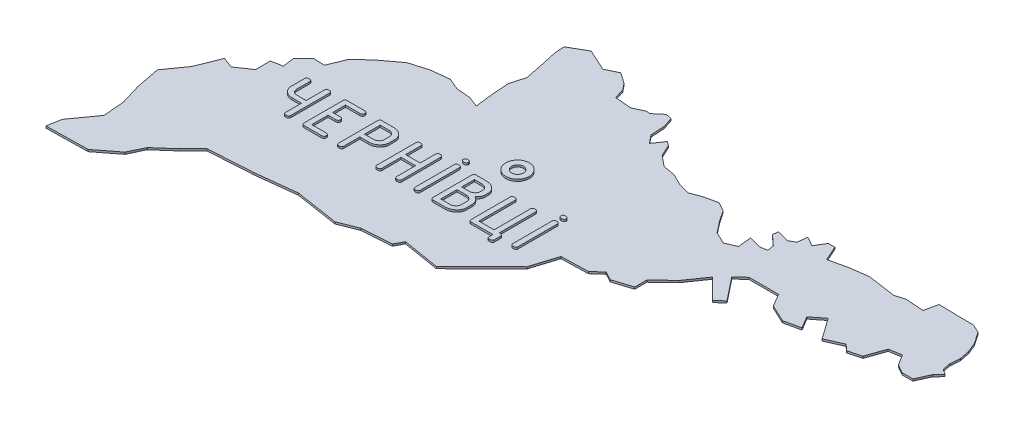
from build123d import *

# Parameters (mm, degrees)
EXTRUDE_1_DEPTH = 5
SKETCH_2_R      = 30
SKETCH_2_R_2    = 15
EXTRUDE_2_DEPTH = 10
SCALE_1_SCALE   = 0.05


with BuildPart() as part:
    # Эскиз1 → Бобышка-Вытянуть1 (new body)
    with BuildSketch(Plane(origin=(0, 0, 0), x_dir=(1, 0, 0), z_dir=(0, 1, 0))):
        Polygon((-5161.27238, 3670.78768), (-5205.41504, 3609.16728), (-5211.88188, 3573.49044), (-5106.11882, 3575.42084), (-5053.5586, 3616.30722), (-5034.72704, 3655.20986), (-4991.90264, 3692.87044), (-4956.1877, 3728.57268), (-4843.29232, 3735.71262), (-4741.41292, 3747.3763), (-4631.74334, 3730.50308), (-4584.3571, 3749.3321), (-4509.09182, 3754.51624), (-4497.41544, 3776.5482), (-4403.32368, 3760.99578), (-4287.14154, 3875.87744), (-4266.38212, 3942.07238), (-4198.25678, 3944.00532), (-4174.24362, 3965.42514), (-4152.16086, 3953.73606), (-4104.79494, 3968.65348), (-4104.79494, 3999.80658), (-4061.97816, 4040.69296), (-4027.57132, 4090.01468), (-3976.31666, 4038.76256), (-3956.19224, 4055.60784), (-4003.55816, 4115.32324), (-3980.2054, 4136.0852), (-3904.94012, 4136.0852), (-3886.10856, 4103.63416), (-3841.97098, 4082.87474), (-3801.0846, 4091.94762), (-3819.27862, 4122.46572), (-3788.78592, 4146.47888), (-3751.12788, 4093.29382), (-3708.9715, 4112.09744), (-3693.36828, 4098.45256), (-3660.91978, 4106.8879), (-3644.04656, 4154.91422), (-3612.91886, 4160.09836), (-3596.02024, 4132.83146), (-3573.96288, 4120.50738), (-3546.72392, 4120.50738), (-3531.1715, 4154.91422), (-3515.56828, 4171.78744), (-3529.1903, 4180.22278), (-3533.1019, 4200.98474), (-3531.1715, 4226.2933), (-3536.33024, 4252.26226), (-3546.72392, 4277.54796), (-3566.82294, 4306.76812), (-3588.9057, 4317.1364), (-3621.3542, 4317.1364), (-3677.793, 4318.4572), (-3684.95834, 4284.7133), (-3731.02632, 4287.9391), (-3756.33742, 4280.79916), (-3792.01426, 4286.0087), (-3828.3515, 4291.16744), (-3874.44488, 4284.7133), (-3920.49, 4274.31962), (-3937.38862, 4311.97766), (-3954.23644, 4311.97766), (-3969.81172, 4286.0087), (-3993.82488, 4299.62818), (-3997.07862, 4274.31962), (-4012.65644, 4265.88428), (-4043.14914, 4274.31962), (-4045.10494, 4260.67474), (-4019.13598, 4236.68698), (-4015.88224, 4219.81376), (-4034.73666, 4216.56002), (-4065.22936, 4224.9979), (-4061.97816, 4190.61646), (-4089.24252, 4178.92738), (-4119.73522, 4193.8702), (-4142.45298, 4223.03956), (-4160.6216, 4250.30646), (-4183.31396, 4262.63054), (-4215.765, 4255.516), (-4244.32476, 4245.09692), (-4275.47786, 4253.5348), (-4302.71936, 4267.17968), (-4333.23746, 4272.36382), (-4360.50436, 4294.41864), (-4374.10606, 4323.64134), (-4384.50736, 4332.07922), (-4403.32368, 4304.81232), (-4420.1969, 4325.57428), (-4422.14508, 4361.27652), (-4430.56772, 4387.24548), (-4446.15316, 4390.47128), (-4468.2156, 4371.66766), (-4479.88436, 4371.66766), (-4505.84316, 4359.31818), (-4548.01224, 4363.20692), (-4555.14456, 4388.54088), (-4568.78436, 4405.4141), (-4596.0411, 4424.21772), (-4626.56174, 4409.30284), (-4681.7153, 4434.6114), (-4725.84526, 4409.30284), (-4723.88184, 4383.33134), (-4714.15872, 4339.19376), (-4705.06298, 4294.41864), (-4715.4592, 4257.4464), (-4712.21054, 4211.37842), (-4707.01878, 4166.6033), (-4734.27806, 4176.99698), (-4769.96506, 4180.22278), (-4799.16998, 4192.54686), (-4845.23796, 4187.36272), (-4891.32372, 4173.71784), (-4937.38662, 4139.311), (-4973.07108, 4106.8879), (-4990.60216, 4062.77572), (-5019.14668, 4064.07112), (-5045.10548, 4038.76256), (-5041.21928, 4008.26986), (-5053.5586, 4006.31152), (-5069.1288, 4003.06032), (-5069.1288, 3965.42514), (-5106.11882, 3940.11658), (-5133.35778, 3950.51026), (-5157.38618, 3890.79486), (-5193.72342, 3839.5402), (-5181.39934, 3776.5482), (-5165.81644, 3725.34434), align=None)
    extrude(amount=EXTRUDE_1_DEPTH)

    # Эскиз2 → Бобышка-Вытянуть2 (add)
    # profile 1 of 11: a face of its own
    with BuildSketch(Plane(origin=(0, 0, 0), x_dir=(1, 0, 0), z_dir=(0, 1, 0))):
        with Locations((-4508.775463682, 4073.729250327)):
            Circle(SKETCH_2_R)
        with Locations((-4508.775463682, 4073.729250327)):
            Circle(SKETCH_2_R_2, mode=Mode.SUBTRACT)
    # profile 2 of 11: a face of its own
    with BuildSketch(Plane(origin=(0, 0, 0), x_dir=(1, 0, 0), z_dir=(0, 1, 0))):
        with BuildLine():
            add(Edge.make_bspline(
                [(-4917.826249408, 3903.987056014), (-4917.844690549, 3903.565801509), (-4917.879584535, 3902.768711543), (-4918.248312806, 3901.655076453), (-4918.83065955, 3900.699261706), (-4919.685246985, 3899.936444301), (-4920.759842504, 3899.355634957), (-4922.057831983, 3898.93916639), (-4923.587270184, 3898.726594693), (-4924.677446337, 3898.688520887), (-4925.25868184, 3898.668221555)],
                knots=[0, 0, 0, 0, 0.969647621, 1.834749252, 2.678145047, 3.526077294, 4.446504318, 5.481227067, 6.657097526, 8, 8, 8, 8], degree=3))
            add(Edge.make_bspline(
                [(-4925.25868184, 3898.668221555), (-4925.723940264, 3898.688499106), (-4926.598901589, 3898.726632908), (-4927.830659773, 3898.941910676), (-4928.874604274, 3899.364080839), (-4929.737808092, 3899.953473867), (-4930.417264304, 3900.724233693), (-4930.872869644, 3901.673384986), (-4931.16288374, 3902.777909588), (-4931.190123026, 3903.56691517), (-4931.204627786, 3903.987056014)],
                knots=[0, 0, 0, 0, 1.22289028, 2.299757822, 3.266537475, 4.157864275, 5.022578284, 5.932048079, 6.898827733, 8, 8, 8, 8], degree=3))
            Line((-4931.204627786, 3903.987056014), (-4931.204627786, 3944.749302636))
            Line((-4931.204627786, 3944.749302636), (-4955.034864273, 3944.749302636))
            add(Edge.make_bspline(
                [(-4955.034864273, 3944.749302636), (-4955.941545879, 3944.773337174), (-4957.729801934, 3944.820740705), (-4960.359890824, 3945.144157756), (-4962.883181385, 3945.710642727), (-4965.313465846, 3946.473940617), (-4967.643594822, 3947.472039052), (-4969.857232111, 3948.719955339), (-4971.97763393, 3950.157361872), (-4973.960646787, 3951.805334498), (-4975.793893662, 3953.589931273), (-4977.363815414, 3955.531692443), (-4978.743468761, 3957.534086294), (-4979.820550445, 3959.659948403), (-4980.707143885, 3961.860537681), (-4981.294090947, 3964.173561537), (-4981.687963806, 3966.576305345), (-4981.725927628, 3968.214036598), (-4981.745168327, 3969.044066149)],
                knots=[0, 0, 0, 0, 1.083579438, 2.137153193, 3.160845387, 4.170431534, 5.177640383, 6.184211502, 7.203083336, 8.234980693, 9.262221224, 10.255046752, 11.214855753, 12.162546035, 13.097273895, 14.04437677, 15.008857485, 16, 16, 16, 16], degree=3))
            Line((-4981.745168327, 3969.044066149), (-4981.745168327, 4003.372613447))
            add(Edge.make_bspline(
                [(-4981.745168327, 4003.372613447), (-4981.728735531, 4003.784515802), (-4981.69730543, 4004.57233866), (-4981.42402358, 4005.675163761), (-4980.950087466, 4006.616021563), (-4980.279192274, 4007.383360451), (-4979.41489523, 4007.972246535), (-4978.371277608, 4008.394568277), (-4977.139418737, 4008.609799354), (-4976.264472684, 4008.647940238), (-4975.799222381, 4008.668221555)],
                knots=[0, 0, 0, 0, 1.083429305, 2.072215321, 2.965634013, 3.832377457, 4.725796149, 5.694844779, 6.774239667, 8, 8, 8, 8], degree=3))
            add(Edge.make_bspline(
                [(-4975.799222381, 4008.668221555), (-4975.21703827, 4008.661983655), (-4974.123529441, 4008.650267089), (-4972.606249543, 4008.380544142), (-4971.294753307, 4008.012898498), (-4970.234459703, 4007.419468993), (-4969.371693823, 4006.687033476), (-4968.789418429, 4005.751757391), (-4968.419849355, 4004.661346861), (-4968.385143076, 4003.879153041), (-4968.366789948, 4003.465518852)],
                knots=[0, 0, 0, 0, 1.353106154, 2.541521659, 3.579288285, 4.507284885, 5.350131461, 6.185231121, 7.040326791, 8, 8, 8, 8], degree=3))
            Line((-4968.366789948, 4003.465518852), (-4968.366789948, 3969.973120203))
            add(Edge.make_bspline(
                [(-4968.366789948, 3969.973120203), (-4968.322261709, 3969.022857744), (-4968.236334693, 3967.189117649), (-4967.438663149, 3964.574250496), (-4966.109613179, 3962.25859278), (-4964.309143334, 3960.274705052), (-4962.194219218, 3958.646866986), (-4959.837418654, 3957.514780262), (-4957.341185778, 3956.762655988), (-4955.613311475, 3956.682192457), (-4954.732921705, 3956.641194528)],
                knots=[0, 0, 0, 0, 1.071822769, 2.068317408, 3.05593699, 4.065977023, 5.077494084, 6.051885237, 7.007392896, 8, 8, 8, 8], degree=3))
            Line((-4954.732921705, 3956.641194528), (-4931.204627786, 3956.641194528))
            Line((-4931.204627786, 3956.641194528), (-4931.204627786, 4003.465518852))
            add(Edge.make_bspline(
                [(-4931.204627786, 4003.465518852), (-4931.190218805, 4003.878022311), (-4931.163184173, 4004.6519757), (-4930.87252494, 4005.733080087), (-4930.417796291, 4006.662178241), (-4929.728858494, 4007.404144775), (-4928.881055608, 4008.003649824), (-4927.821338832, 4008.37892355), (-4926.60405322, 4008.649678129), (-4925.725057064, 4008.661793445), (-4925.25868184, 4008.668221555)],
                knots=[0, 0, 0, 0, 1.091529518, 2.047965782, 2.948064081, 3.805939007, 4.706037306, 5.674741692, 6.76627121, 8, 8, 8, 8], degree=3))
            add(Edge.make_bspline(
                [(-4925.25868184, 4008.668221555), (-4924.677446337, 4008.647922222), (-4923.587270184, 4008.609848416), (-4922.057831983, 4008.39727672), (-4920.759842504, 4007.980808153), (-4919.685246985, 4007.399998808), (-4918.83065955, 4006.637181403), (-4918.248312806, 4005.681366656), (-4917.879584535, 4004.567731567), (-4917.844690549, 4003.770641601), (-4917.826249408, 4003.349387095)],
                knots=[0, 0, 0, 0, 1.342902474, 2.518772933, 3.553495682, 4.473922706, 5.321854953, 6.165250748, 7.030352379, 8, 8, 8, 8], degree=3))
            Line((-4917.826249408, 4003.349387095), (-4917.826249408, 3903.987056014))
        make_face()
    # profile 3 of 11: a face of its own
    with BuildSketch(Plane(origin=(0, 0, 0), x_dir=(1, 0, 0), z_dir=(0, 1, 0))):
        with BuildLine():
            Line((-4870.853276435, 3952.181735068), (-4870.853276435, 3910.560113447))
            Line((-4870.853276435, 3910.560113447), (-4834.945337246, 3910.560113447))
            add(Edge.make_bspline(
                [(-4834.945337246, 3910.560113447), (-4834.371097199, 3910.545374798), (-4833.29991302, 3910.517881404), (-4831.802092299, 3910.238936529), (-4830.524243772, 3909.777462689), (-4829.451486105, 3909.133608449), (-4828.627983832, 3908.2636496), (-4828.067036346, 3907.202344324), (-4827.707016996, 3905.968724481), (-4827.671150878, 3905.081435255), (-4827.652262921, 3904.614167501)],
                knots=[0, 0, 0, 0, 1.28106213, 2.389686149, 3.385119505, 4.301299487, 5.157282531, 6.023675155, 6.959220009, 8, 8, 8, 8], degree=3))
            add(Edge.make_bspline(
                [(-4827.652262921, 3904.614167501), (-4827.671150878, 3904.146899746), (-4827.707016996, 3903.259610521), (-4828.067036346, 3902.025990677), (-4828.627983832, 3900.964685401), (-4829.451486105, 3900.094726552), (-4830.524243772, 3899.450872312), (-4831.802092299, 3898.989398472), (-4833.29991302, 3898.710453598), (-4834.371097199, 3898.682960204), (-4834.945337246, 3898.668221555)],
                knots=[0, 0, 0, 0, 1.040779991, 1.976324845, 2.842717469, 3.698700513, 4.614880495, 5.610313851, 6.71893787, 8, 8, 8, 8], degree=3))
            Line((-4834.945337246, 3898.668221555), (-4878.285708867, 3898.668221555))
            add(Edge.make_bspline(
                [(-4878.285708867, 3898.668221555), (-4878.750967291, 3898.688499106), (-4879.625928616, 3898.726632908), (-4880.8576868, 3898.941910676), (-4881.901631301, 3899.364080839), (-4882.764835119, 3899.953473867), (-4883.444291331, 3900.724233693), (-4883.899896671, 3901.673384986), (-4884.189910767, 3902.777909588), (-4884.217150053, 3903.56691517), (-4884.231654813, 3903.987056014)],
                knots=[0, 0, 0, 0, 1.22289028, 2.299757822, 3.266537475, 4.157864275, 5.022578284, 5.932048079, 6.898827733, 8, 8, 8, 8], degree=3))
            Line((-4884.231654813, 3903.987056014), (-4884.231654813, 4003.349387095))
            add(Edge.make_bspline(
                [(-4884.231654813, 4003.349387095), (-4884.217150053, 4003.769527939), (-4884.189910767, 4004.558533521), (-4883.899896671, 4005.663058124), (-4883.444291331, 4006.612209416), (-4882.764835119, 4007.382969243), (-4881.901631301, 4007.972362271), (-4880.8576868, 4008.394532434), (-4879.625928616, 4008.609810201), (-4878.750967291, 4008.647944004), (-4878.285708867, 4008.668221555)],
                knots=[0, 0, 0, 0, 1.101172267, 2.067951921, 2.977421716, 3.842135725, 4.733462525, 5.700242178, 6.77710972, 8, 8, 8, 8], degree=3))
            Line((-4878.285708867, 4008.668221555), (-4834.945337246, 4008.668221555))
            add(Edge.make_bspline(
                [(-4834.945337246, 4008.668221555), (-4834.371097199, 4008.653482906), (-4833.29991302, 4008.625989512), (-4831.802092299, 4008.347044637), (-4830.524243772, 4007.885570797), (-4829.451486105, 4007.241716557), (-4828.627983832, 4006.371757709), (-4828.067036346, 4005.310452432), (-4827.707016996, 4004.076832589), (-4827.671150878, 4003.189543363), (-4827.652262921, 4002.722275609)],
                knots=[0, 0, 0, 0, 1.28106213, 2.389686149, 3.385119505, 4.301299487, 5.157282531, 6.023675155, 6.959220009, 8, 8, 8, 8], degree=3))
            add(Edge.make_bspline(
                [(-4827.652262921, 4002.722275609), (-4827.671150878, 4002.255007854), (-4827.707016996, 4001.367718629), (-4828.067036346, 4000.134098786), (-4828.627983832, 3999.072793509), (-4829.451486105, 3998.20283466), (-4830.524243772, 3997.55898042), (-4831.802092299, 3997.09750658), (-4833.29991302, 3996.818561706), (-4834.371097199, 3996.791068312), (-4834.945337246, 3996.776329663)],
                knots=[0, 0, 0, 0, 1.040779991, 1.976324845, 2.842717469, 3.698700513, 4.614880495, 5.610313851, 6.71893787, 8, 8, 8, 8], degree=3))
            Line((-4834.945337246, 3996.776329663), (-4870.853276435, 3996.776329663))
            Line((-4870.853276435, 3996.776329663), (-4870.853276435, 3964.07362696))
            Line((-4870.853276435, 3964.07362696), (-4852.225742651, 3964.07362696))
            add(Edge.make_bspline(
                [(-4852.225742651, 3964.07362696), (-4851.651502604, 3964.058888311), (-4850.580318426, 3964.031394917), (-4849.082497704, 3963.752450043), (-4847.804649177, 3963.290976203), (-4846.731891511, 3962.647121963), (-4845.908389237, 3961.777163114), (-4845.347441751, 3960.715857837), (-4844.987422401, 3959.482237994), (-4844.951556283, 3958.594948768), (-4844.932668327, 3958.127681014)],
                knots=[0, 0, 0, 0, 1.28106213, 2.389686149, 3.385119505, 4.301299487, 5.157282531, 6.023675155, 6.959220009, 8, 8, 8, 8], degree=3))
            add(Edge.make_bspline(
                [(-4844.932668327, 3958.127681014), (-4844.951556283, 3957.66041326), (-4844.987422401, 3956.773124034), (-4845.347441751, 3955.539504191), (-4845.908389237, 3954.478198914), (-4846.731891511, 3953.608240066), (-4847.804649177, 3952.964385826), (-4849.082497704, 3952.502911986), (-4850.580318426, 3952.223967111), (-4851.651502604, 3952.196473717), (-4852.225742651, 3952.181735068)],
                knots=[0, 0, 0, 0, 1.040779991, 1.976324845, 2.842717469, 3.698700513, 4.614880495, 5.610313851, 6.71893787, 8, 8, 8, 8], degree=3))
            Line((-4852.225742651, 3952.181735068), (-4870.853276435, 3952.181735068))
        make_face()
    # profile 4 of 11: a face of its own
    with BuildSketch(Plane(origin=(0, 0, 0), x_dir=(1, 0, 0), z_dir=(0, 1, 0))):
        with BuildLine():
            Line((-4782.25868184, 3944.749302636), (-4782.25868184, 3903.987056014))
            add(Edge.make_bspline(
                [(-4782.25868184, 3903.987056014), (-4782.277122982, 3903.565801509), (-4782.312016967, 3902.768711543), (-4782.680745239, 3901.655076453), (-4783.263091982, 3900.699261706), (-4784.117679417, 3899.936444301), (-4785.192274936, 3899.355634957), (-4786.490264416, 3898.93916639), (-4788.019702616, 3898.726594693), (-4789.10987877, 3898.688520887), (-4789.691114273, 3898.668221555)],
                knots=[0, 0, 0, 0, 0.969647621, 1.834749252, 2.678145047, 3.526077294, 4.446504318, 5.481227067, 6.657097526, 8, 8, 8, 8], degree=3))
            add(Edge.make_bspline(
                [(-4789.691114273, 3898.668221555), (-4790.156372697, 3898.688499106), (-4791.031334021, 3898.726632908), (-4792.263092205, 3898.941910676), (-4793.307036706, 3899.364080839), (-4794.170240525, 3899.953473867), (-4794.849696736, 3900.724233693), (-4795.305302077, 3901.673384986), (-4795.595316172, 3902.777909588), (-4795.622555458, 3903.56691517), (-4795.637060219, 3903.987056014)],
                knots=[0, 0, 0, 0, 1.22289028, 2.299757822, 3.266537475, 4.157864275, 5.022578284, 5.932048079, 6.898827733, 8, 8, 8, 8], degree=3))
            Line((-4795.637060219, 3903.987056014), (-4795.637060219, 4003.349387095))
            add(Edge.make_bspline(
                [(-4795.637060219, 4003.349387095), (-4795.619468207, 4003.76870838), (-4795.586509995, 4004.554296771), (-4795.336078643, 4005.667288512), (-4794.8698622, 4006.604840256), (-4794.221812484, 4007.374344193), (-4793.398382954, 4007.979457785), (-4792.385977338, 4008.389450697), (-4791.194797718, 4008.611341927), (-4790.350141068, 4008.648451489), (-4789.900151435, 4008.668221555)],
                knots=[0, 0, 0, 0, 1.122294232, 2.102591382, 3.029506031, 3.897298159, 4.771993288, 5.738165652, 6.795010956, 8, 8, 8, 8], degree=3))
            Line((-4789.900151435, 4008.668221555), (-4760.216874408, 4008.668221555))
            add(Edge.make_bspline(
                [(-4760.216874408, 4008.668221555), (-4759.232427909, 4008.647325569), (-4757.295909088, 4008.606220776), (-4754.462367849, 4008.240855811), (-4751.735130129, 4007.697559022), (-4749.144111548, 4006.874363944), (-4746.647218022, 4005.851981189), (-4744.289834826, 4004.56952028), (-4742.03794036, 4003.075349674), (-4739.95292172, 4001.364211435), (-4738.027641024, 3999.527747904), (-4736.361026592, 3997.572682065), (-4734.917041871, 3995.563922632), (-4733.753820842, 3993.464945208), (-4732.841204593, 3991.292538735), (-4732.177063197, 3989.043861503), (-4731.810867806, 3986.715820098), (-4731.749141601, 3985.141094583), (-4731.7181413, 3984.35023169)],
                knots=[0, 0, 0, 0, 1.137513349, 2.237618817, 3.297790624, 4.347980102, 5.375150095, 6.412292281, 7.444906539, 8.494638285, 9.5263601, 10.51652419, 11.460172715, 12.381617667, 13.284179448, 14.179165903, 15.085535792, 16, 16, 16, 16], degree=3))
            Line((-4731.7181413, 3984.35023169), (-4731.7181413, 3968.997613447))
            add(Edge.make_bspline(
                [(-4731.7181413, 3968.997613447), (-4731.73619381, 3968.206069668), (-4731.772177251, 3966.628312944), (-4732.192650065, 3964.310413164), (-4732.810012872, 3962.062506057), (-4733.708071689, 3959.894314874), (-4734.881550009, 3957.812520187), (-4736.273260431, 3955.778053047), (-4737.943843211, 3953.844000418), (-4739.835411695, 3952.006990707), (-4741.892155103, 3950.295089803), (-4744.127582143, 3948.823904591), (-4746.46700327, 3947.569826429), (-4748.940249112, 3946.537138222), (-4751.526543805, 3945.721020542), (-4754.253205034, 3945.176374238), (-4757.086905088, 3944.811381045), (-4759.023401924, 3944.770224785), (-4760.007837246, 3944.749302636)],
                knots=[0, 0, 0, 0, 0.917983992, 1.829785608, 2.726215166, 3.620975603, 4.546454897, 5.496449022, 6.478273818, 7.508059585, 8.555428521, 9.580101314, 10.609612414, 11.632983234, 12.687770733, 13.752584266, 14.857506301, 16, 16, 16, 16], degree=3))
            Line((-4760.007837246, 3944.749302636), (-4782.25868184, 3944.749302636))
        make_face()
        with BuildLine():
            Line((-4782.25868184, 3956.641194528), (-4760.309779813, 3956.641194528))
            add(Edge.make_bspline(
                [(-4760.309779813, 3956.641194528), (-4759.29846938, 3956.681065394), (-4757.31832318, 3956.759132564), (-4754.482900052, 3957.510435084), (-4751.861366988, 3958.683419739), (-4749.552366232, 3960.32450361), (-4747.593001493, 3962.274146211), (-4746.142264081, 3964.481102363), (-4745.249634897, 3966.904179335), (-4745.147938596, 3968.587703369), (-4745.096519678, 3969.438914122)],
                knots=[0, 0, 0, 0, 1.100258597, 2.154306738, 3.173946441, 4.215763079, 5.224202047, 6.169814662, 7.074635462, 8, 8, 8, 8], degree=3))
            Line((-4745.096519678, 3969.438914122), (-4745.096519678, 3983.908931014))
            add(Edge.make_bspline(
                [(-4745.096519678, 3983.908931014), (-4745.148277799, 3984.759925664), (-4745.250644975, 3986.443022289), (-4746.135994477, 3988.86311973), (-4747.607367769, 3991.062067835), (-4749.571837571, 3993.017569291), (-4751.893246792, 3994.687747751), (-4754.505940745, 3995.907751368), (-4757.341927037, 3996.656818695), (-4759.306414158, 3996.735925637), (-4760.309779813, 3996.776329663)],
                knots=[0, 0, 0, 0, 0.924452776, 1.828382056, 2.766002435, 3.785369803, 4.831030871, 5.864385594, 6.909230749, 8, 8, 8, 8], degree=3))
            Line((-4760.309779813, 3996.776329663), (-4782.25868184, 3996.776329663))
            Line((-4782.25868184, 3996.776329663), (-4782.25868184, 3956.641194528))
        make_face(mode=Mode.SUBTRACT)
    # profile 5 of 11: a face of its own
    with BuildSketch(Plane(origin=(0, 0, 0), x_dir=(1, 0, 0), z_dir=(0, 1, 0))):
        with BuildLine():
            Line((-4647.583006165, 3964.07362696), (-4647.583006165, 4003.465518852))
            add(Edge.make_bspline(
                [(-4647.583006165, 4003.465518852), (-4647.568597184, 4003.878022311), (-4647.541562551, 4004.6519757), (-4647.250903319, 4005.733080087), (-4646.79617467, 4006.662178241), (-4646.107236872, 4007.404144775), (-4645.259433987, 4008.003649824), (-4644.19971721, 4008.37892355), (-4642.982431599, 4008.649678129), (-4642.103435443, 4008.661793445), (-4641.637060219, 4008.668221555)],
                knots=[0, 0, 0, 0, 1.091529518, 2.047965782, 2.948064081, 3.805939007, 4.706037306, 5.674741692, 6.76627121, 8, 8, 8, 8], degree=3))
            add(Edge.make_bspline(
                [(-4641.637060219, 4008.668221555), (-4641.055824715, 4008.647922222), (-4639.965648562, 4008.609848416), (-4638.436210362, 4008.39727672), (-4637.138220882, 4007.980808153), (-4636.063625363, 4007.399998808), (-4635.209037928, 4006.637181403), (-4634.626691185, 4005.681366656), (-4634.257962913, 4004.567731567), (-4634.223068928, 4003.770641601), (-4634.204627786, 4003.349387095)],
                knots=[0, 0, 0, 0, 1.342902474, 2.518772933, 3.553495682, 4.473922706, 5.321854953, 6.165250748, 7.030352379, 8, 8, 8, 8], degree=3))
            Line((-4634.204627786, 4003.349387095), (-4634.204627786, 3903.987056014))
            add(Edge.make_bspline(
                [(-4634.204627786, 3903.987056014), (-4634.223068928, 3903.565801509), (-4634.257962913, 3902.768711543), (-4634.626691185, 3901.655076453), (-4635.209037928, 3900.699261706), (-4636.063625363, 3899.936444301), (-4637.138220882, 3899.355634957), (-4638.436210362, 3898.93916639), (-4639.965648562, 3898.726594693), (-4641.055824715, 3898.688520887), (-4641.637060219, 3898.668221555)],
                knots=[0, 0, 0, 0, 0.969647621, 1.834749252, 2.678145047, 3.526077294, 4.446504318, 5.481227067, 6.657097526, 8, 8, 8, 8], degree=3))
            add(Edge.make_bspline(
                [(-4641.637060219, 3898.668221555), (-4642.102318642, 3898.688499106), (-4642.977279967, 3898.726632908), (-4644.209038151, 3898.941910676), (-4645.252982652, 3899.364080839), (-4646.116186471, 3899.953473867), (-4646.795642682, 3900.724233693), (-4647.251248023, 3901.673384986), (-4647.541262118, 3902.777909588), (-4647.568501404, 3903.56691517), (-4647.583006165, 3903.987056014)],
                knots=[0, 0, 0, 0, 1.22289028, 2.299757822, 3.266537475, 4.157864275, 5.022578284, 5.932048079, 6.898827733, 8, 8, 8, 8], degree=3))
            Line((-4647.583006165, 3903.987056014), (-4647.583006165, 3952.181735068))
            Line((-4647.583006165, 3952.181735068), (-4684.745168327, 3952.181735068))
            Line((-4684.745168327, 3952.181735068), (-4684.745168327, 3903.987056014))
            add(Edge.make_bspline(
                [(-4684.745168327, 3903.987056014), (-4684.763609468, 3903.565801509), (-4684.798503454, 3902.768711543), (-4685.167231725, 3901.655076453), (-4685.749578469, 3900.699261706), (-4686.604165904, 3899.936444301), (-4687.678761423, 3899.355634957), (-4688.976750902, 3898.93916639), (-4690.506189103, 3898.726594693), (-4691.596365256, 3898.688520887), (-4692.177600759, 3898.668221555)],
                knots=[0, 0, 0, 0, 0.969647621, 1.834749252, 2.678145047, 3.526077294, 4.446504318, 5.481227067, 6.657097526, 8, 8, 8, 8], degree=3))
            add(Edge.make_bspline(
                [(-4692.177600759, 3898.668221555), (-4692.642859183, 3898.688499106), (-4693.517820508, 3898.726632908), (-4694.749578691, 3898.941910676), (-4695.793523193, 3899.364080839), (-4696.656727011, 3899.953473867), (-4697.336183223, 3900.724233693), (-4697.791788563, 3901.673384986), (-4698.081802659, 3902.777909588), (-4698.109041945, 3903.56691517), (-4698.123546705, 3903.987056014)],
                knots=[0, 0, 0, 0, 1.22289028, 2.299757822, 3.266537475, 4.157864275, 5.022578284, 5.932048079, 6.898827733, 8, 8, 8, 8], degree=3))
            Line((-4698.123546705, 3903.987056014), (-4698.123546705, 4003.349387095))
            add(Edge.make_bspline(
                [(-4698.123546705, 4003.349387095), (-4698.109041945, 4003.769527939), (-4698.081802659, 4004.558533521), (-4697.791788563, 4005.663058124), (-4697.336183223, 4006.612209416), (-4696.656727011, 4007.382969243), (-4695.793523193, 4007.972362271), (-4694.749578691, 4008.394532434), (-4693.517820508, 4008.609810201), (-4692.642859183, 4008.647944004), (-4692.177600759, 4008.668221555)],
                knots=[0, 0, 0, 0, 1.101172267, 2.067951921, 2.977421716, 3.842135725, 4.733462525, 5.700242178, 6.77710972, 8, 8, 8, 8], degree=3))
            add(Edge.make_bspline(
                [(-4692.177600759, 4008.668221555), (-4691.595416649, 4008.661983655), (-4690.50190782, 4008.650267089), (-4688.984627921, 4008.380544142), (-4687.673131685, 4008.012898498), (-4686.612838082, 4007.419468993), (-4685.750072201, 4006.687033476), (-4685.167796807, 4005.751757391), (-4684.798227734, 4004.661346861), (-4684.763521455, 4003.879153041), (-4684.745168327, 4003.465518852)],
                knots=[0, 0, 0, 0, 1.353106154, 2.541521659, 3.579288285, 4.507284885, 5.350131461, 6.185231121, 7.040326791, 8, 8, 8, 8], degree=3))
            Line((-4684.745168327, 4003.465518852), (-4684.745168327, 3964.07362696))
            Line((-4684.745168327, 3964.07362696), (-4647.583006165, 3964.07362696))
        make_face()
    # profile 6 of 11: a face of its own
    with BuildSketch(Plane(origin=(0, 0, 0), x_dir=(1, 0, 0), z_dir=(0, 1, 0))):
        with BuildLine():
            add(Edge.make_bspline(
                [(-4587.231654813, 3904.010282366), (-4587.251619112, 3903.589595066), (-4587.289745543, 3902.786195681), (-4587.641776522, 3901.664815694), (-4588.244004202, 3900.718803179), (-4589.095791998, 3899.962419302), (-4590.157918589, 3899.349931415), (-4591.464413161, 3898.941366228), (-4592.992314659, 3898.725919401), (-4594.082726228, 3898.688286053), (-4594.664087246, 3898.668221555)],
                knots=[0, 0, 0, 0, 0.968349646, 1.849286893, 2.676465977, 3.523263178, 4.451261044, 5.484598709, 6.658895142, 8, 8, 8, 8], degree=3))
            add(Edge.make_bspline(
                [(-4594.664087246, 3898.668221555), (-4595.129472743, 3898.68831336), (-4596.00467304, 3898.72609785), (-4597.234855653, 3898.943678669), (-4598.288116585, 3899.360032829), (-4599.137058307, 3899.978543071), (-4599.816042726, 3900.742119781), (-4600.288555999, 3901.684963743), (-4600.564158717, 3902.794765377), (-4600.594191666, 3903.590536019), (-4600.610033192, 3904.010282366)],
                knots=[0, 0, 0, 0, 1.220860227, 2.29594012, 3.261114875, 4.162696787, 5.025975332, 5.915822489, 6.900655729, 8, 8, 8, 8], degree=3))
            Line((-4600.610033192, 3904.010282366), (-4600.610033192, 4004.022951284))
            add(Edge.make_bspline(
                [(-4600.610033192, 4004.022951284), (-4600.594015874, 4004.442529327), (-4600.563649651, 4005.237980891), (-4600.290276151, 4006.34991679), (-4599.807638974, 4007.290906033), (-4599.152885632, 4008.080157791), (-4598.278603541, 4008.66805648), (-4597.236500653, 4009.091662503), (-4596.004175204, 4009.306497988), (-4595.129299918, 4009.344698873), (-4594.664087246, 4009.365012095)],
                knots=[0, 0, 0, 0, 1.098843442, 2.08322802, 2.972669788, 3.850929026, 4.740370794, 5.705105844, 6.779695961, 8, 8, 8, 8], degree=3))
            add(Edge.make_bspline(
                [(-4594.664087246, 4009.365012095), (-4594.082910323, 4009.344656362), (-4592.992844046, 4009.306476768), (-4591.462688624, 4009.094595608), (-4590.166956825, 4008.675953359), (-4589.080518024, 4008.099535315), (-4588.252085303, 4007.312769484), (-4587.640312003, 4006.370147037), (-4587.290164906, 4005.246542849), (-4587.251763236, 4004.443468424), (-4587.231654813, 4004.022951284)],
                knots=[0, 0, 0, 0, 1.340544031, 2.514349394, 3.547254935, 4.466065479, 5.324653274, 6.151486447, 7.032055301, 8, 8, 8, 8], degree=3))
            Line((-4587.231654813, 4004.022951284), (-4587.231654813, 3904.010282366))
        make_face()
    # profile 7 of 11: a face of its own
    with BuildSketch(Plane(origin=(0, 0, 0), x_dir=(1, 0, 0), z_dir=(0, 1, 0))):
        with BuildLine():
            add(Edge.make_bspline(
                [(-4594.664087246, 4032.452005339), (-4594.082851742, 4032.431706006), (-4592.992675589, 4032.3936322), (-4591.463237389, 4032.181060503), (-4590.165247909, 4031.764591937), (-4589.09065239, 4031.183782592), (-4588.236064955, 4030.420965187), (-4587.653718212, 4029.46515044), (-4587.28498994, 4028.35151535), (-4587.250095955, 4027.554425385), (-4587.231654813, 4027.133170879)],
                knots=[0, 0, 0, 0, 1.342902474, 2.518772933, 3.553495682, 4.473922706, 5.321854953, 6.165250748, 7.030352379, 8, 8, 8, 8], degree=3))
            add(Edge.make_bspline(
                [(-4587.231654813, 4027.133170879), (-4587.250615495, 4026.704543143), (-4587.286514261, 4025.89301076), (-4587.646812768, 4024.759253441), (-4588.243775595, 4023.799191235), (-4589.081592444, 4023.011133563), (-4590.166386611, 4022.431954555), (-4591.465108703, 4022.021787145), (-4592.990116998, 4021.770956344), (-4594.082391483, 4021.738640803), (-4594.664087246, 4021.721431014)],
                knots=[0, 0, 0, 0, 0.981339183, 1.857995784, 2.696169867, 3.550943068, 4.465671455, 5.493987931, 6.665411832, 8, 8, 8, 8], degree=3))
            add(Edge.make_bspline(
                [(-4594.664087246, 4021.721431014), (-4595.129924553, 4021.738691797), (-4596.007507759, 4021.7712091), (-4597.23356271, 4022.024564921), (-4598.279164489, 4022.43984484), (-4599.152032129, 4023.030314775), (-4599.814998459, 4023.822597921), (-4600.284355196, 4024.778353739), (-4600.566793439, 4025.901850971), (-4600.595017488, 4026.705575128), (-4600.610033192, 4027.133170879)],
                knots=[0, 0, 0, 0, 1.213876563, 2.286801999, 3.246455683, 4.131212664, 5.004846013, 5.90761226, 6.886811976, 8, 8, 8, 8], degree=3))
            add(Edge.make_bspline(
                [(-4600.610033192, 4027.133170879), (-4600.595528431, 4027.553311723), (-4600.568289145, 4028.342317305), (-4600.27827505, 4029.446841908), (-4599.822669709, 4030.3959932), (-4599.143213498, 4031.166753026), (-4598.280009679, 4031.756146055), (-4597.236065178, 4032.178316217), (-4596.004306994, 4032.393593985), (-4595.12934567, 4032.431727788), (-4594.664087246, 4032.452005339)],
                knots=[0, 0, 0, 0, 1.101172267, 2.067951921, 2.977421716, 3.842135725, 4.733462525, 5.700242178, 6.77710972, 8, 8, 8, 8], degree=3))
        make_face()
    # profile 8 of 11: a face of its own
    with BuildSketch(Plane(origin=(0, 0, 0), x_dir=(1, 0, 0), z_dir=(0, 1, 0))):
        with BuildLine():
            add(Edge.make_bspline(
                [(-4549.293732516, 3898.668221555), (-4549.751315103, 3898.688420657), (-4550.611043887, 3898.72637173), (-4551.819485331, 3898.942145804), (-4552.842943915, 3899.362843177), (-4553.680212092, 3899.962116203), (-4554.364440864, 3900.717547059), (-4554.785343445, 3901.680420293), (-4555.083991859, 3902.77679311), (-4555.109802624, 3903.566527229), (-4555.123546705, 3903.987056014)],
                knots=[0, 0, 0, 0, 1.215450489, 2.283648459, 3.241767166, 4.125814096, 4.999768287, 5.90995031, 6.8870608, 8, 8, 8, 8], degree=3))
            Line((-4555.123546705, 3903.987056014), (-4555.123546705, 4003.349387095))
            add(Edge.make_bspline(
                [(-4555.123546705, 4003.349387095), (-4555.109802624, 4003.769915881), (-4555.083991859, 4004.559649999), (-4554.785343445, 4005.656022817), (-4554.364440864, 4006.618896051), (-4553.680212092, 4007.374326907), (-4552.842943915, 4007.973599932), (-4551.819485331, 4008.394297306), (-4550.611043887, 4008.61007138), (-4549.751315103, 4008.648022452), (-4549.293732516, 4008.668221555)],
                knots=[0, 0, 0, 0, 1.1129392, 2.09004969, 3.000231713, 3.874185904, 4.758232834, 5.716351541, 6.784549511, 8, 8, 8, 8], degree=3))
            Line((-4549.293732516, 4008.668221555), (-4523.210539948, 4008.668221555))
            add(Edge.make_bspline(
                [(-4523.210539948, 4008.668221555), (-4522.211173998, 4008.643623971), (-4520.245799304, 4008.59524983), (-4517.357516996, 4008.282346129), (-4514.598533512, 4007.679642693), (-4511.94584877, 4006.910730433), (-4509.423970368, 4005.862229237), (-4506.99140921, 4004.651445871), (-4504.717605441, 4003.139499524), (-4502.566834031, 4001.461608727), (-4500.622017802, 3999.627988081), (-4498.900230816, 3997.70342441), (-4497.438689098, 3995.716413579), (-4496.227684521, 3993.653344432), (-4495.323620975, 3991.501150977), (-4494.67336897, 3989.288534068), (-4494.25895939, 3987.005633592), (-4494.204963669, 3985.459115305), (-4494.177600759, 3984.675400609)],
                knots=[0, 0, 0, 0, 1.150379196, 2.262360609, 3.337195863, 4.397265122, 5.436454705, 6.476598987, 7.519602122, 8.573134406, 9.613278688, 10.591580615, 11.541550965, 12.447889777, 13.338318919, 14.220865623, 15.098404611, 16, 16, 16, 16], degree=3))
            Line((-4494.177600759, 3984.675400609), (-4494.177600759, 3977.196515474))
            add(Edge.make_bspline(
                [(-4494.177600759, 3977.196515474), (-4494.212001454, 3976.30462572), (-4494.279438532, 3974.556218042), (-4494.716653082, 3971.996902979), (-4495.501520725, 3969.59397249), (-4496.537059616, 3967.311763989), (-4497.936150956, 3965.206877283), (-4499.625133171, 3963.246999181), (-4501.603701025, 3961.415797698), (-4503.113345526, 3960.377825899), (-4503.886215624, 3959.846431014)],
                knots=[0, 0, 0, 0, 1.029175045, 2.017533605, 2.983682694, 3.938867564, 4.90017294, 5.888450762, 6.918981744, 8, 8, 8, 8], degree=3))
            add(Edge.make_bspline(
                [(-4503.886215624, 3959.846431014), (-4502.909751265, 3959.404410601), (-4500.949208028, 3958.516922876), (-4498.276006207, 3956.615153278), (-4495.869918523, 3954.256762809), (-4493.746583329, 3951.525151761), (-4491.974323219, 3948.557639559), (-4490.66513177, 3945.443638738), (-4489.86851142, 3942.242059631), (-4489.768087499, 3940.069632158), (-4489.7181413, 3938.989167501)],
                knots=[0, 0, 0, 0, 0.964273661, 1.936066775, 2.937786417, 3.991640234, 5.045932872, 6.043756463, 7.027055204, 8, 8, 8, 8], degree=3))
            Line((-4489.7181413, 3938.989167501), (-4489.7181413, 3923.450738447))
            add(Edge.make_bspline(
                [(-4489.7181413, 3923.450738447), (-4489.74606674, 3922.674808571), (-4489.801443347, 3921.136126902), (-4490.213676706, 3918.851205395), (-4490.881339676, 3916.617558366), (-4491.856072715, 3914.446495127), (-4493.060788526, 3912.3184964), (-4494.577585929, 3910.264837479), (-4496.337332019, 3908.248950565), (-4498.346696116, 3906.320078788), (-4500.516356097, 3904.523602883), (-4502.836162979, 3902.956448791), (-4505.250912857, 3901.626440402), (-4507.782280561, 3900.552797989), (-4510.411501609, 3899.716378467), (-4513.140066764, 3899.116668669), (-4515.968070506, 3898.725395522), (-4517.890384471, 3898.687485573), (-4518.867212246, 3898.668221555)],
                knots=[0, 0, 0, 0, 0.882787033, 1.750581164, 2.634291316, 3.529915433, 4.453497835, 5.412349596, 6.430319429, 7.495991431, 8.579153591, 9.632549757, 10.677620012, 11.712047917, 12.757118173, 13.813275057, 14.888811245, 16, 16, 16, 16], degree=3))
            Line((-4518.867212246, 3898.668221555), (-4549.293732516, 3898.668221555))
        make_face()
        with BuildLine():
            Line((-4541.745168327, 3964.07362696), (-4523.256992651, 3964.07362696))
            add(Edge.make_bspline(
                [(-4523.256992651, 3964.07362696), (-4522.206440747, 3964.110643571), (-4520.154530318, 3964.182943444), (-4517.223835175, 3964.970229596), (-4514.503823179, 3966.150501545), (-4512.139904826, 3967.853648076), (-4510.103937771, 3969.80299415), (-4508.64201718, 3972.018512939), (-4507.701723931, 3974.399278777), (-4507.604860759, 3976.057671493), (-4507.555979137, 3976.894572906)],
                knots=[0, 0, 0, 0, 1.122646912, 2.192724507, 3.228442999, 4.282199383, 5.296716912, 6.230574863, 7.107066509, 8, 8, 8, 8], degree=3))
            Line((-4507.555979137, 3976.894572906), (-4507.555979137, 3984.025062771))
            add(Edge.make_bspline(
                [(-4507.555979137, 3984.025062771), (-4507.605133102, 3984.861790238), (-4507.702535946, 3986.519838264), (-4508.636358564, 3988.897114322), (-4510.106613303, 3991.092995721), (-4512.139318199, 3993.024116849), (-4514.517302213, 3994.689283827), (-4517.213048056, 3995.917306521), (-4520.159465515, 3996.657105718), (-4522.207470379, 3996.735933508), (-4523.256992651, 3996.776329663)],
                knots=[0, 0, 0, 0, 0.894731847, 1.772988735, 2.701801869, 3.712537987, 4.763664448, 5.804889969, 6.875092093, 8, 8, 8, 8], degree=3))
            Line((-4523.256992651, 3996.776329663), (-4541.745168327, 3996.776329663))
            Line((-4541.745168327, 3996.776329663), (-4541.745168327, 3964.07362696))
        make_face(mode=Mode.SUBTRACT)
        with BuildLine():
            Line((-4541.745168327, 3910.560113447), (-4518.913664948, 3910.560113447))
            add(Edge.make_bspline(
                [(-4518.913664948, 3910.560113447), (-4517.848109177, 3910.607192922), (-4515.774685633, 3910.698803043), (-4512.794473056, 3911.472991087), (-4510.059988523, 3912.703535352), (-4507.663460012, 3914.432430859), (-4505.635892348, 3916.459897692), (-4504.161252927, 3918.780740916), (-4503.244448915, 3921.309679737), (-4503.146169846, 3923.071602364), (-4503.096519678, 3923.961718176)],
                knots=[0, 0, 0, 0, 1.110699144, 2.161266278, 3.19190746, 4.223403722, 5.229191067, 6.166341496, 7.073643527, 8, 8, 8, 8], degree=3))
            Line((-4503.096519678, 3923.961718176), (-4503.096519678, 3938.849809393))
            add(Edge.make_bspline(
                [(-4503.096519678, 3938.849809393), (-4503.14313845, 3939.740871769), (-4503.235170093, 3941.499947159), (-4504.190489391, 3944.004660675), (-4505.665355663, 3946.307296455), (-4507.687905815, 3948.342450587), (-4510.099795018, 3950.045450794), (-4512.818425032, 3951.305618522), (-4515.794872209, 3952.032065134), (-4517.856802967, 3952.131016577), (-4518.913664948, 3952.181735068)],
                knots=[0, 0, 0, 0, 0.928968279, 1.833906673, 2.766860823, 3.775483924, 4.816502152, 5.842683559, 6.894247191, 8, 8, 8, 8], degree=3))
            Line((-4518.913664948, 3952.181735068), (-4541.745168327, 3952.181735068))
            Line((-4541.745168327, 3952.181735068), (-4541.745168327, 3910.560113447))
        make_face(mode=Mode.SUBTRACT)
    # profile 9 of 11: a face of its own
    with BuildSketch(Plane(origin=(0, 0, 0), x_dir=(1, 0, 0), z_dir=(0, 1, 0))):
        with BuildLine():
            add(Edge.make_bspline(
                [(-4383.285708867, 3889.261549257), (-4383.305730657, 3888.83319924), (-4383.343984156, 3888.014796527), (-4383.695494006, 3886.870683486), (-4384.297398757, 3885.902931205), (-4385.141804681, 3885.119699192), (-4386.212804801, 3884.507984878), (-4387.520440542, 3884.105974273), (-4389.043779543, 3883.852189119), (-4390.136309489, 3883.820325699), (-4390.7181413, 3883.80335669)],
                knots=[0, 0, 0, 0, 0.978196174, 1.868935147, 2.704424746, 3.5564603, 4.476991117, 5.502014125, 6.669686219, 8, 8, 8, 8], degree=3))
            add(Edge.make_bspline(
                [(-4390.7181413, 3883.80335669), (-4391.183257023, 3883.823836962), (-4392.057949987, 3883.862352001), (-4393.291477501, 3884.075116238), (-4394.325630765, 3884.503768996), (-4395.204832482, 3885.062510418), (-4395.868593086, 3885.833767171), (-4396.333737352, 3886.759884352), (-4396.622119811, 3887.843378776), (-4396.649496144, 3888.616973465), (-4396.664087246, 3889.029285744)],
                knots=[0, 0, 0, 0, 1.233611578, 2.319920209, 3.295175793, 4.182775495, 5.055070607, 5.954211828, 6.90963111, 8, 8, 8, 8], degree=3))
            Line((-4396.664087246, 3889.029285744), (-4396.664087246, 3898.668221555))
            Line((-4396.664087246, 3898.668221555), (-4451.780219002, 3898.668221555))
            add(Edge.make_bspline(
                [(-4451.780219002, 3898.668221555), (-4452.237793943, 3898.688423975), (-4453.097508359, 3898.72638128), (-4454.306044369, 3898.942114331), (-4455.329196282, 3899.362944737), (-4456.167496873, 3899.961769906), (-4456.843202162, 3900.713593702), (-4457.282203753, 3901.668600972), (-4457.564358364, 3902.762961129), (-4457.594351626, 3903.551534771), (-4457.610033192, 3903.963829663)],
                knots=[0, 0, 0, 0, 1.218361906, 2.289118575, 3.249532302, 4.135696826, 5.011744435, 5.905540226, 6.904940489, 8, 8, 8, 8], degree=3))
            Line((-4457.610033192, 3903.963829663), (-4457.610033192, 4003.372613447))
            add(Edge.make_bspline(
                [(-4457.610033192, 4003.372613447), (-4457.593600396, 4003.784515802), (-4457.562170295, 4004.57233866), (-4457.288888445, 4005.675163761), (-4456.814952331, 4006.616021563), (-4456.144057139, 4007.383360451), (-4455.279760095, 4007.972246535), (-4454.236142473, 4008.394568277), (-4453.004283602, 4008.609799354), (-4452.129337549, 4008.647940238), (-4451.664087246, 4008.668221555)],
                knots=[0, 0, 0, 0, 1.083429305, 2.072215321, 2.965634013, 3.832377457, 4.725796149, 5.694844779, 6.774239667, 8, 8, 8, 8], degree=3))
            add(Edge.make_bspline(
                [(-4451.664087246, 4008.668221555), (-4451.082999585, 4008.647664716), (-4449.993100729, 4008.609107927), (-4448.46185245, 4008.399688946), (-4447.173089392, 4007.974460484), (-4446.083505768, 4007.427479412), (-4445.24524702, 4006.661181451), (-4444.647018897, 4005.724696995), (-4444.288741474, 4004.620720574), (-4444.251279857, 4003.83216652), (-4444.231654813, 4003.419066149)],
                knots=[0, 0, 0, 0, 1.349898262, 2.531894363, 3.572007453, 4.488635547, 5.340985057, 6.173587819, 7.043196157, 8, 8, 8, 8], degree=3))
            Line((-4444.231654813, 4003.419066149), (-4444.231654813, 3910.560113447))
            Line((-4444.231654813, 3910.560113447), (-4405.583006165, 3910.560113447))
            Line((-4405.583006165, 3910.560113447), (-4405.583006165, 4003.419066149))
            add(Edge.make_bspline(
                [(-4405.583006165, 4003.419066149), (-4405.56745604, 4003.831141728), (-4405.537997462, 4004.611788908), (-4405.257454443, 4005.705301797), (-4404.787158554, 4006.637724899), (-4404.123846399, 4007.409090988), (-4403.244521324, 4007.967802334), (-4402.210405248, 4008.396464159), (-4400.976866235, 4008.609225592), (-4400.102175015, 4008.647741056), (-4399.637060219, 4008.668221555)],
                knots=[0, 0, 0, 0, 1.087671966, 2.060515348, 2.957432629, 3.827570202, 4.712974511, 5.685817892, 6.769439643, 8, 8, 8, 8], degree=3))
            add(Edge.make_bspline(
                [(-4399.637060219, 4008.668221555), (-4399.055972558, 4008.647664716), (-4397.966073702, 4008.609107927), (-4396.434825423, 4008.399688946), (-4395.146062365, 4007.974460484), (-4394.056478741, 4007.427479412), (-4393.218219993, 4006.661181451), (-4392.61999187, 4005.724696995), (-4392.261714447, 4004.620720574), (-4392.22425283, 4003.83216652), (-4392.204627786, 4003.419066149)],
                knots=[0, 0, 0, 0, 1.349898262, 2.531894363, 3.572007453, 4.488635547, 5.340985057, 6.173587819, 7.043196157, 8, 8, 8, 8], degree=3))
            Line((-4392.204627786, 4003.419066149), (-4392.204627786, 3910.560113447))
            Line((-4392.204627786, 3910.560113447), (-4390.764594002, 3910.560113447))
            add(Edge.make_bspline(
                [(-4390.764594002, 3910.560113447), (-4390.182949592, 3910.542354172), (-4389.083134238, 3910.508773651), (-4387.550034788, 3910.262089979), (-4386.232164502, 3909.84874752), (-4385.145147355, 3909.251342296), (-4384.29780947, 3908.459797759), (-4383.695377681, 3907.492996571), (-4383.344017443, 3906.34861354), (-4383.305742094, 3905.530250258), (-4383.285708867, 3905.101920879)],
                knots=[0, 0, 0, 0, 1.324874151, 2.505167947, 3.525999654, 4.458082004, 5.306633599, 6.138706896, 7.025803653, 8, 8, 8, 8], degree=3))
            Line((-4383.285708867, 3905.101920879), (-4383.285708867, 3889.261549257))
        make_face()
    # profile 10 of 11: a face of its own
    with BuildSketch(Plane(origin=(0, 0, 0), x_dir=(1, 0, 0), z_dir=(0, 1, 0))):
        with BuildLine():
            add(Edge.make_bspline(
                [(-4337.799222381, 3904.010282366), (-4337.81918668, 3903.589595066), (-4337.857313111, 3902.786195681), (-4338.209344089, 3901.664815694), (-4338.811571769, 3900.718803179), (-4339.663359566, 3899.962419302), (-4340.725486156, 3899.349931415), (-4342.031980728, 3898.941366228), (-4343.559882226, 3898.725919401), (-4344.650293796, 3898.688286053), (-4345.231654813, 3898.668221555)],
                knots=[0, 0, 0, 0, 0.968349646, 1.849286893, 2.676465977, 3.523263178, 4.451261044, 5.484598709, 6.658895142, 8, 8, 8, 8], degree=3))
            add(Edge.make_bspline(
                [(-4345.231654813, 3898.668221555), (-4345.69704031, 3898.68831336), (-4346.572240607, 3898.72609785), (-4347.80242322, 3898.943678669), (-4348.855684152, 3899.360032829), (-4349.704625874, 3899.978543071), (-4350.383610294, 3900.742119781), (-4350.856123566, 3901.684963743), (-4351.131726284, 3902.794765377), (-4351.161759234, 3903.590536019), (-4351.177600759, 3904.010282366)],
                knots=[0, 0, 0, 0, 1.220860227, 2.29594012, 3.261114875, 4.162696787, 5.025975332, 5.915822489, 6.900655729, 8, 8, 8, 8], degree=3))
            Line((-4351.177600759, 3904.010282366), (-4351.177600759, 4004.022951284))
            add(Edge.make_bspline(
                [(-4351.177600759, 4004.022951284), (-4351.161583442, 4004.442529327), (-4351.131217219, 4005.237980891), (-4350.857843718, 4006.34991679), (-4350.375206542, 4007.290906033), (-4349.720453199, 4008.080157791), (-4348.846171108, 4008.66805648), (-4347.80406822, 4009.091662503), (-4346.571742772, 4009.306497988), (-4345.696867486, 4009.344698873), (-4345.231654813, 4009.365012095)],
                knots=[0, 0, 0, 0, 1.098843442, 2.08322802, 2.972669788, 3.850929026, 4.740370794, 5.705105844, 6.779695961, 8, 8, 8, 8], degree=3))
            add(Edge.make_bspline(
                [(-4345.231654813, 4009.365012095), (-4344.650477891, 4009.344656362), (-4343.560411613, 4009.306476768), (-4342.030256191, 4009.094595608), (-4340.734524393, 4008.675953359), (-4339.648085592, 4008.099535315), (-4338.819652871, 4007.312769484), (-4338.20787957, 4006.370147037), (-4337.857732474, 4005.246542849), (-4337.819330804, 4004.443468424), (-4337.799222381, 4004.022951284)],
                knots=[0, 0, 0, 0, 1.340544031, 2.514349394, 3.547254935, 4.466065479, 5.324653274, 6.151486447, 7.032055301, 8, 8, 8, 8], degree=3))
            Line((-4337.799222381, 4004.022951284), (-4337.799222381, 3904.010282366))
        make_face()
    # profile 11 of 11: a face of its own
    with BuildSketch(Plane(origin=(0, 0, 0), x_dir=(1, 0, 0), z_dir=(0, 1, 0))):
        with BuildLine():
            add(Edge.make_bspline(
                [(-4345.231654813, 4032.452005339), (-4344.65041931, 4032.431706006), (-4343.560243157, 4032.3936322), (-4342.030804956, 4032.181060503), (-4340.732815477, 4031.764591937), (-4339.658219958, 4031.183782592), (-4338.803632523, 4030.420965187), (-4338.221285779, 4029.46515044), (-4337.852557508, 4028.35151535), (-4337.817663522, 4027.554425385), (-4337.799222381, 4027.133170879)],
                knots=[0, 0, 0, 0, 1.342902474, 2.518772933, 3.553495682, 4.473922706, 5.321854953, 6.165250748, 7.030352379, 8, 8, 8, 8], degree=3))
            add(Edge.make_bspline(
                [(-4337.799222381, 4027.133170879), (-4337.818183062, 4026.704543143), (-4337.854081829, 4025.89301076), (-4338.214380336, 4024.759253441), (-4338.811343163, 4023.799191235), (-4339.649160011, 4023.011133563), (-4340.733954179, 4022.431954555), (-4342.032676271, 4022.021787145), (-4343.557684566, 4021.770956344), (-4344.64995905, 4021.738640803), (-4345.231654813, 4021.721431014)],
                knots=[0, 0, 0, 0, 0.981339183, 1.857995784, 2.696169867, 3.550943068, 4.465671455, 5.493987931, 6.665411832, 8, 8, 8, 8], degree=3))
            add(Edge.make_bspline(
                [(-4345.231654813, 4021.721431014), (-4345.697492121, 4021.738691797), (-4346.575075327, 4021.7712091), (-4347.801130278, 4022.024564921), (-4348.846732057, 4022.43984484), (-4349.719599697, 4023.030314775), (-4350.382566026, 4023.822597921), (-4350.851922764, 4024.778353739), (-4351.134361006, 4025.901850971), (-4351.162585056, 4026.705575128), (-4351.177600759, 4027.133170879)],
                knots=[0, 0, 0, 0, 1.213876563, 2.286801999, 3.246455683, 4.131212664, 5.004846013, 5.90761226, 6.886811976, 8, 8, 8, 8], degree=3))
            add(Edge.make_bspline(
                [(-4351.177600759, 4027.133170879), (-4351.163095999, 4027.553311723), (-4351.135856713, 4028.342317305), (-4350.845842617, 4029.446841908), (-4350.390237277, 4030.3959932), (-4349.710781065, 4031.166753026), (-4348.847577247, 4031.756146055), (-4347.803632745, 4032.178316217), (-4346.571874562, 4032.393593985), (-4345.696913237, 4032.431727788), (-4345.231654813, 4032.452005339)],
                knots=[0, 0, 0, 0, 1.101172267, 2.067951921, 2.977421716, 3.842135725, 4.733462525, 5.700242178, 6.77710972, 8, 8, 8, 8], degree=3))
        make_face()
    extrude(amount=EXTRUDE_2_DEPTH)


with BuildPart() as part_1:
    # Масштаб1: scaled about (-4508.366930546, 2.698027153, -4033.377030884)
    add(part.part.scale(SCALE_1_SCALE).moved(Location((-4282.948584019, 2.563125795, -3831.70817934))))


solid = part_1.part
